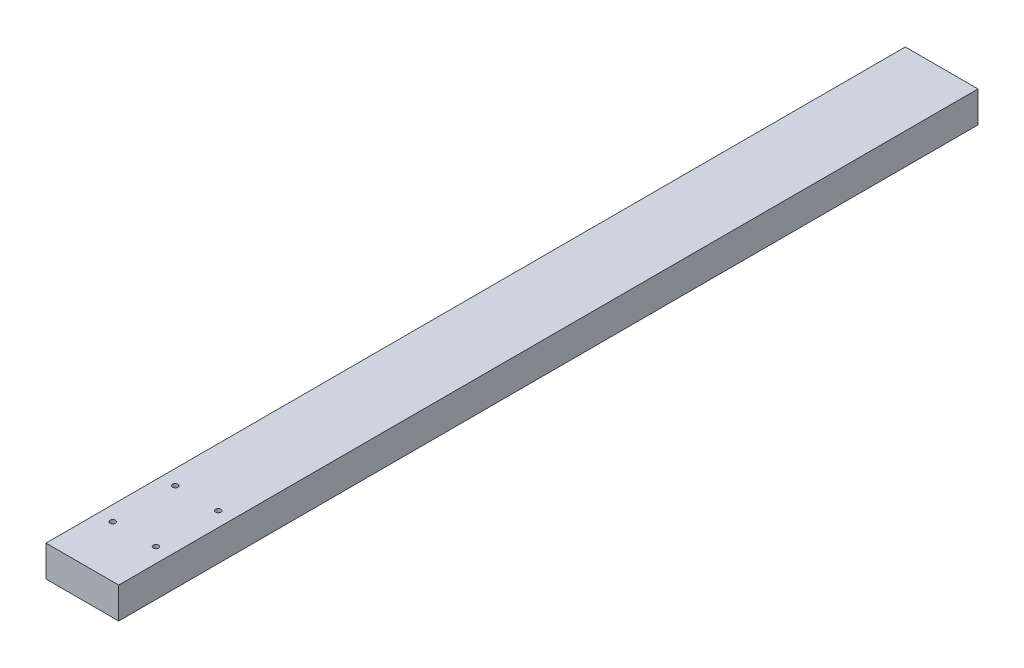
from build123d import *

# Parameters (mm, degrees)
SKETCH1_W           = 88.9
SKETCH1_H           = 38.1
BOSS_EXTRUDE1_DEPTH = 1050.8
CUT_EXTRUDE1_REACH  = 1054.43
SKETCH2_R           = 3.25


with BuildPart() as part:
    # Sketch1 → Boss-Extrude1 (new body)
    with BuildSketch(Plane.XY):
        Rectangle(SKETCH1_W, SKETCH1_H)
    extrude(amount=BOSS_EXTRUDE1_DEPTH)

    # Sketch2 → Cut-Extrude1 (cut, up to next)
    with BuildSketch(Plane(origin=(0, 19.05, 0), x_dir=(1, 0, 0), z_dir=(0, 1, 0)), mode=Mode.PRIVATE) as cut_extrude1_sk1:
        with Locations((26.549149341, -987.3)):
            Circle(SKETCH2_R)
    cut_extrude1_tool1 = extrude(cut_extrude1_sk1.sketch, amount=-CUT_EXTRUDE1_REACH, mode=Mode.PRIVATE) & part.part
    # Sketch2 → Cut-Extrude1 (cut, up to next)
    with BuildSketch(Plane(origin=(0, 19.05, 0), x_dir=(1, 0, 0), z_dir=(0, 1, 0)), mode=Mode.PRIVATE) as cut_extrude1_sk2:
        with Locations((-26.216883177, -987.3)):
            Circle(SKETCH2_R)
    cut_extrude1_tool2 = extrude(cut_extrude1_sk2.sketch, amount=-CUT_EXTRUDE1_REACH, mode=Mode.PRIVATE) & part.part
    # Sketch2 → Cut-Extrude1 (cut, up to next)
    with BuildSketch(Plane(origin=(0, 19.05, 0), x_dir=(1, 0, 0), z_dir=(0, 1, 0)), mode=Mode.PRIVATE) as cut_extrude1_sk3:
        with Locations((26.549149341, -911.1)):
            Circle(SKETCH2_R)
    cut_extrude1_tool3 = extrude(cut_extrude1_sk3.sketch, amount=-CUT_EXTRUDE1_REACH, mode=Mode.PRIVATE) & part.part
    # Sketch2 → Cut-Extrude1 (cut, up to next)
    with BuildSketch(Plane(origin=(0, 19.05, 0), x_dir=(1, 0, 0), z_dir=(0, 1, 0)), mode=Mode.PRIVATE) as cut_extrude1_sk4:
        with Locations((-26.216883177, -911.1)):
            Circle(SKETCH2_R)
    cut_extrude1_tool4 = extrude(cut_extrude1_sk4.sketch, amount=-CUT_EXTRUDE1_REACH, mode=Mode.PRIVATE) & part.part
    add(cut_extrude1_tool1.solids().sort_by_distance((26.549149, 19.05, 987.3))[0], mode=Mode.SUBTRACT)
    add(cut_extrude1_tool2.solids().sort_by_distance((-26.216883, 19.05, 987.3))[0], mode=Mode.SUBTRACT)
    add(cut_extrude1_tool3.solids().sort_by_distance((26.549149, 19.05, 911.1))[0], mode=Mode.SUBTRACT)
    add(cut_extrude1_tool4.solids().sort_by_distance((-26.216883, 19.05, 911.1))[0], mode=Mode.SUBTRACT)


solid = part.part
